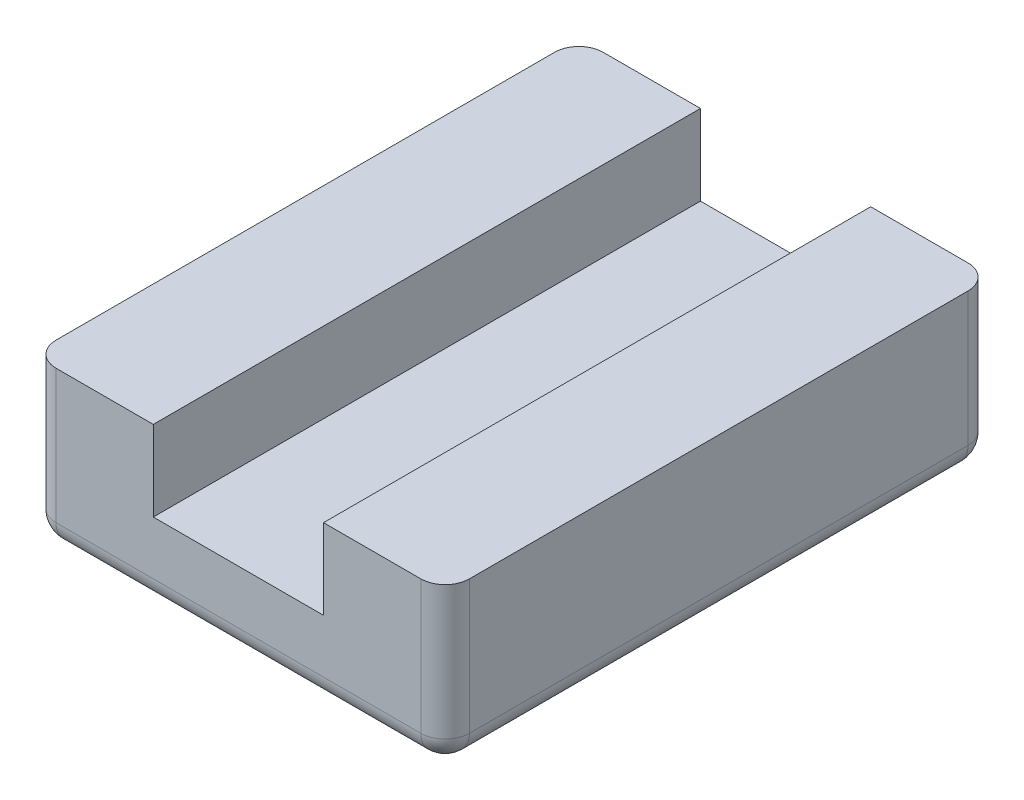
from build123d import *

# Parameters (mm, degrees)
EXTRUDE_1_DEPTH     = 22.5
CUT_EXTRUDE_1_DEPTH = 2.5
FILLET_1_R          = 1
FILLET_2_R          = 1


with BuildPart() as part:
    # 草图1 → 凸台-拉伸1 (new body)
    with BuildSketch(Plane.XY):
        Polygon((-8.5, 3.25), (-8.5, -3.25), (8.5, -3.25), (8.5, 3.25), (3.5, 3.25), (3.5, -0.05), (-3.5, -0.05), (-3.5, 3.25), align=None)
    extrude(amount=-EXTRUDE_1_DEPTH)

    # 草图2 → 切除-拉伸1 (cut)
    with BuildSketch(Plane.XZ.offset(3.25)):
        with BuildLine():
            Line((-6, -8.25), (-6, -7.25))
            Line((-6, -7.25), (-5, -7.25))
            ThreePointArc((-5, -7.25), (-6.707106781, -6.542893219), (-6, -8.25))
        make_face()
        with BuildLine():
            Line((-5, -7.25), (-6, -7.25))
            Line((-6, -7.25), (-6, -8.25))
            ThreePointArc((-6, -8.25), (-5.292893219, -7.957106781), (-5, -7.25))
        make_face()
        with BuildLine():
            ThreePointArc((7, -7.25), (6, -6.25), (5, -7.25))
            Line((5, -7.25), (6, -7.25))
            Line((6, -7.25), (6, -8.25))
            ThreePointArc((6, -8.25), (6.707106781, -7.957106781), (7, -7.25))
        make_face()
        with BuildLine():
            Line((6, -7.25), (5, -7.25))
            ThreePointArc((5, -7.25), (5.292893219, -7.957106781), (6, -8.25))
            Line((6, -8.25), (6, -7.25))
        make_face()
        with BuildLine():
            ThreePointArc((7, -15.25), (6.707106781, -14.542893219), (6, -14.25))
            Line((6, -14.25), (6, -15.25))
            Line((6, -15.25), (5, -15.25))
            ThreePointArc((5, -15.25), (6, -16.25), (7, -15.25))
        make_face()
        with BuildLine():
            Line((6, -15.25), (6, -14.25))
            ThreePointArc((6, -14.25), (5.292893219, -14.542893219), (5, -15.25))
            Line((5, -15.25), (6, -15.25))
        make_face()
        with BuildLine():
            ThreePointArc((-5, -15.25), (-5.292893219, -14.542893219), (-6, -14.25))
            Line((-6, -14.25), (-6, -15.25))
            Line((-6, -15.25), (-5, -15.25))
        make_face()
        with BuildLine():
            Line((-6, -15.25), (-6, -14.25))
            ThreePointArc((-6, -14.25), (-6.707106781, -15.957106781), (-5, -15.25))
            Line((-5, -15.25), (-6, -15.25))
        make_face()
    extrude(amount=-CUT_EXTRUDE_1_DEPTH, mode=Mode.SUBTRACT)

    # 圆角1
    fillet_1_edges = [part.edges().sort_by_distance(p)[0] for p in [
        (0, -3.25, 0),
        (8.5, -3.25, -11.25),
        (-8.5, -3.25, -11.25),
        (0, -3.25, -22.5),
    ]]
    fillet(fillet_1_edges, radius=FILLET_1_R)

    # 圆角2
    # the kernel refuses this fillet: 1 mm, written as the material it takes off along each edge
    with BuildSketch(Plane(origin=(-7.5, -2.25, -1), x_dir=(0, 0, 1), z_dir=(-1, 0, 0))) as fillet_2_piece_1_section:
        Polygon((0, 0), (FILLET_2_R, 0), (FILLET_2_R, -FILLET_2_R), (0, -FILLET_2_R), align=None)
    fillet_2_piece_1 = extrude(amount=FILLET_2_R, mode=Mode.PRIVATE)
    fillet_2_piece_1 = fillet_2_piece_1 - Plane(origin=(-7.5, -2.25, -1), x_dir=(0, 0.7071067811865475, -0.7071067811865475), z_dir=(-1, 0, 0)) * Sphere(FILLET_2_R, mode=Mode.PRIVATE)
    add(fillet_2_piece_1, mode=Mode.SUBTRACT)
    with BuildSketch(Plane(origin=(7.5, -2.25, -1), x_dir=(1, 0, 0), z_dir=(0, 0, 1))) as fillet_2_piece_2_section:
        Polygon((0, 0), (FILLET_2_R, 0), (FILLET_2_R, -FILLET_2_R), (0, -FILLET_2_R), align=None)
    fillet_2_piece_2 = extrude(amount=FILLET_2_R, mode=Mode.PRIVATE)
    fillet_2_piece_2 = fillet_2_piece_2 - Plane(origin=(7.5, -2.25, -1), x_dir=(-0.7071067811865475, 0.7071067811865475, 0), z_dir=(0, 0, 1)) * Sphere(FILLET_2_R, mode=Mode.PRIVATE)
    add(fillet_2_piece_2, mode=Mode.SUBTRACT)
    with BuildSketch(Plane(origin=(-7.5, -2.25, -21.5), x_dir=(0, 0, -1), z_dir=(-1, 0, 0))) as fillet_2_piece_3_section:
        Polygon((0, 0), (FILLET_2_R, 0), (FILLET_2_R, FILLET_2_R), (0, FILLET_2_R), align=None)
    fillet_2_piece_3 = extrude(amount=FILLET_2_R, mode=Mode.PRIVATE)
    fillet_2_piece_3 = fillet_2_piece_3 - Plane(origin=(-7.5, -2.25, -21.5), x_dir=(0, 0.7071067811865475, 0.7071067811865475), z_dir=(-1, 0, 0)) * Sphere(FILLET_2_R, mode=Mode.PRIVATE)
    add(fillet_2_piece_3, mode=Mode.SUBTRACT)
    with BuildSketch(Plane(origin=(7.5, -2.25, -21.5), x_dir=(1, 0, 0), z_dir=(0, 0, -1))) as fillet_2_piece_4_section:
        Polygon((0, 0), (FILLET_2_R, 0), (FILLET_2_R, FILLET_2_R), (0, FILLET_2_R), align=None)
    fillet_2_piece_4 = extrude(amount=FILLET_2_R, mode=Mode.PRIVATE)
    fillet_2_piece_4 = fillet_2_piece_4 - Plane(origin=(7.5, -2.25, -21.5), x_dir=(-0.7071067811865475, 0.7071067811865475, 0), z_dir=(0, 0, -1)) * Sphere(FILLET_2_R, mode=Mode.PRIVATE)
    add(fillet_2_piece_4, mode=Mode.SUBTRACT)
    with BuildSketch(Plane(origin=(8.5, -2.25, -22.5), x_dir=(-1, 0, 0), z_dir=(0, 1, 0)), Plane(origin=(-8.5, 5.75, 0), x_dir=(0, 0, -1), z_dir=(0, -1, 0))) as fillet_2_piece_5:
        with BuildLine():
            CenterArc((FILLET_2_R, FILLET_2_R), FILLET_2_R, 180, 90)
            Line((0, FILLET_2_R), (0, 0))
            Line((0, 0), (FILLET_2_R, 0))
        make_face()
    extrude(amount=8, mode=Mode.SUBTRACT)
    with BuildSketch(Plane(origin=(-8.5, 5.75, -22.5), x_dir=(0, 0, 1), z_dir=(0, -1, 0)), Plane(origin=(8.5, -2.25, 0), x_dir=(-1, 0, 0), z_dir=(0, 1, 0))) as fillet_2_piece_6:
        with BuildLine():
            CenterArc((FILLET_2_R, -FILLET_2_R), FILLET_2_R, 90, 90)
            Line((0, -FILLET_2_R), (0, 0))
            Line((0, 0), (FILLET_2_R, 0))
        make_face()
    extrude(amount=8, mode=Mode.SUBTRACT)


solid = part.part
